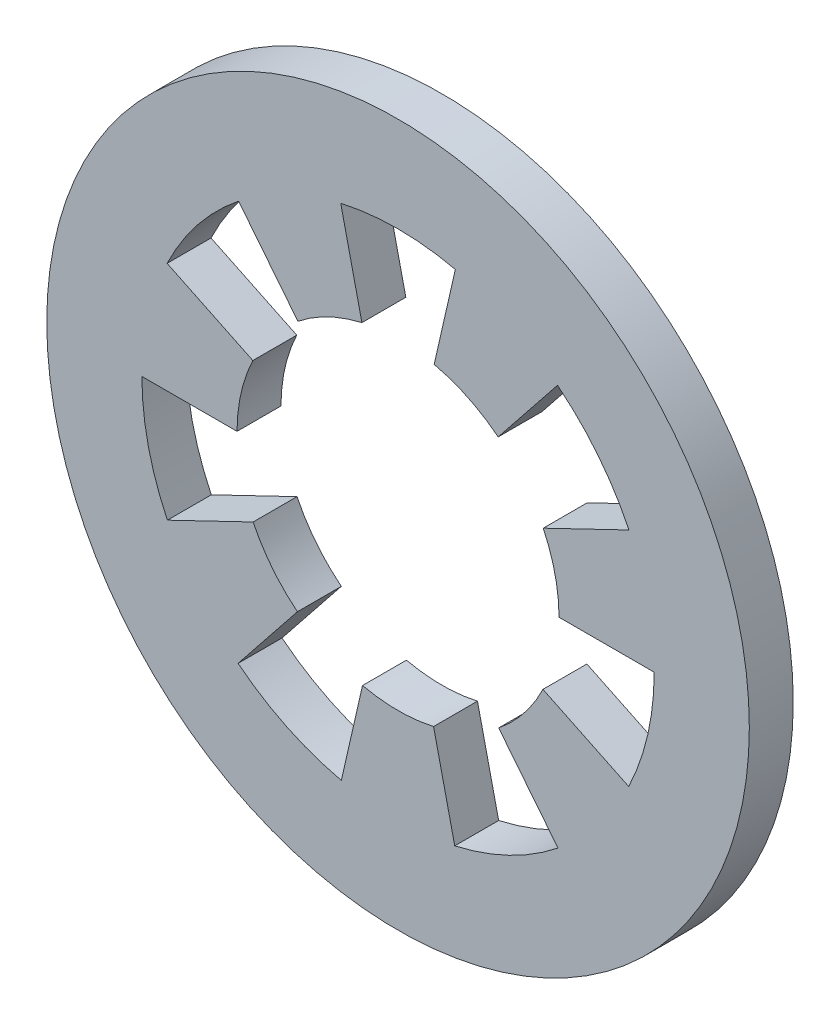
from build123d import *

# Parameters (mm, degrees)
BODYSKE_W      = 1.3
BODYSKE_H      = 0.3
TOOTHCUT_DEPTH = 4.407345007
TOOTHPAT_COUNT = 7


with BuildPart() as part:
    # BodySke → BaseBody (revolve)
    with BuildSketch(Plane(origin=(0, 0, 0), x_dir=(1, 0, 0), z_dir=(0, 1, 0))):
        with Locations((1.75, 0.15)):
            Rectangle(BODYSKE_W, BODYSKE_H)
    revolve(axis=Axis((0, 0, 0), (0, 0, -1)))

    # ToothSke → ToothCut (cut, through all)
    with BuildSketch(Plane.XY):
        with BuildLine():
            Line((-0.391478199, 1.705650849), (-0.246839423, 1.071946967))
            Line((-0.246839423, 1.071946967), (0.246839423, 1.071946967))
            Line((0.246839423, 1.071946967), (0.391478199, 1.705650849))
            ThreePointArc((0.391478199, 1.705650849), (0, 1.75), (-0.391478199, 1.705650849))
        make_face()
    toothcut = extrude(amount=-TOOTHCUT_DEPTH, mode=Mode.SUBTRACT)

    # ToothPat: ToothCut ×7 about axis
    toothpat_axis = Axis((0, 0, 0), (0, 0, -1))
    for i in range(1, TOOTHPAT_COUNT):
        add(toothcut.rotate(toothpat_axis, i * 360 / TOOTHPAT_COUNT), mode=Mode.SUBTRACT)


solid = part.part
